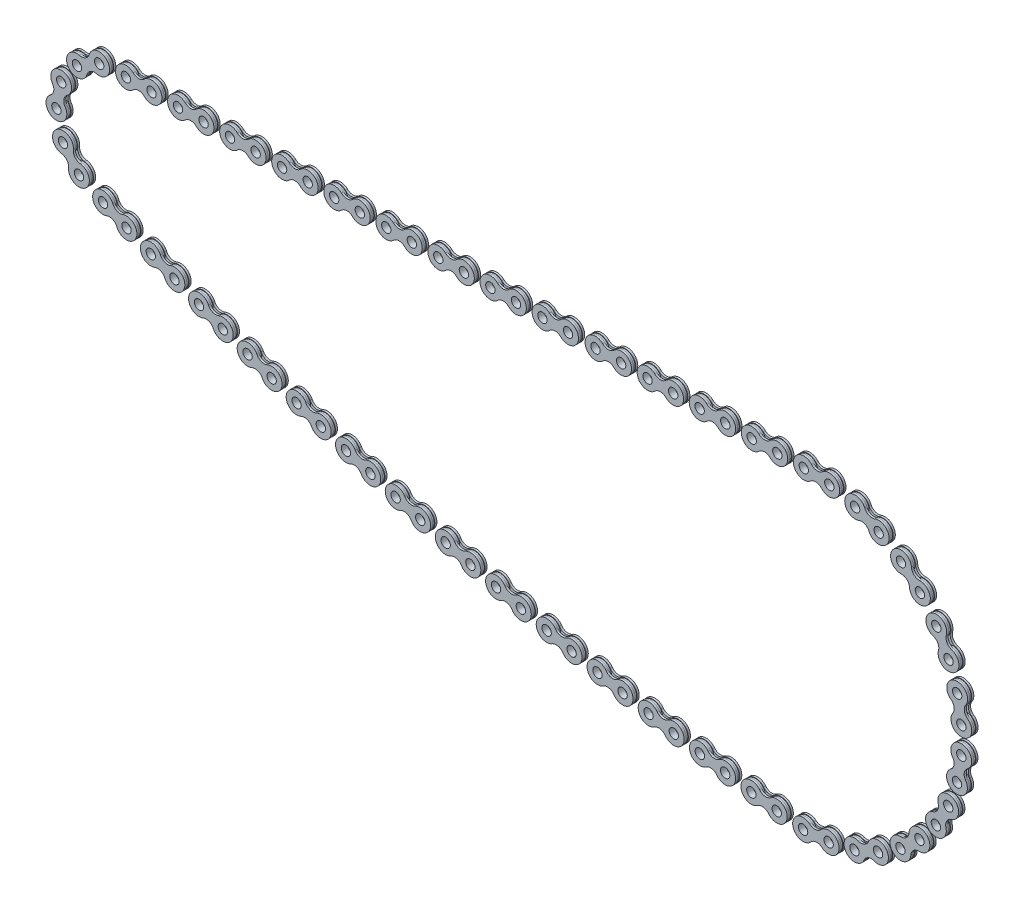
from build123d import *

# Parameters (mm, degrees)
SKETCH1_R             = 4.75
BOSS_EXTRUDE2_DEPTH   = 1
SKETCH1_R_2           = 2.25
BOSS_EXTRUDE2_2_DEPTH = 1
SKETCH2_R             = 2.25
CUT_EXTRUDE1_DEPTH    = 13.057051878
SKETCH3_R             = 2.25
BOSS_EXTRUDE3_DEPTH   = 0.5
CRVPATTERN1_5_ANGLE   = 4.1856236
CRVPATTERN1_6_ANGLE   = 23.2842168
CRVPATTERN1_7_ANGLE   = 42.38281
CRVPATTERN1_8_ANGLE   = 61.4814031
CRVPATTERN1_9_ANGLE   = 80.5799963
CRVPATTERN1_10_ANGLE  = 99.6785895
CRVPATTERN1_11_ANGLE  = 118.7771826
CRVPATTERN1_12_ANGLE  = 137.8757758
CRVPATTERN1_13_ANGLE  = 156.974369
CRVPATTERN1_14_ANGLE  = 176.0729621
CRVPATTERN1_15_ANGLE  = 172.2959829
CRVPATTERN1_16_ANGLE  = 171.0562654
CRVPATTERN1_17_ANGLE  = 169.8165478
CRVPATTERN1_18_ANGLE  = 168.5768302
CRVPATTERN1_19_ANGLE  = 167.3371126
CRVPATTERN1_20_ANGLE  = 166.097395
CRVPATTERN1_21_ANGLE  = 164.8576775
CRVPATTERN1_22_ANGLE  = 163.6179599
CRVPATTERN1_23_ANGLE  = 162.3782423
CRVPATTERN1_24_ANGLE  = 161.1385247
CRVPATTERN1_25_ANGLE  = 159.8988071
CRVPATTERN1_26_ANGLE  = 158.6590895
CRVPATTERN1_27_ANGLE  = 157.419372
CRVPATTERN1_28_ANGLE  = 156.1796544
CRVPATTERN1_29_ANGLE  = 128.6350594
CRVPATTERN1_30_ANGLE  = 79.2591722
CRVPATTERN1_31_ANGLE  = 29.883285


with BuildPart() as part:
    # Sketch1 → Boss-Extrude2 (new, symmetric)
    with BuildSketch(Plane.XY):
        with Locations((-6.15, 0)):
            Circle(SKETCH1_R)
    extrude(amount=BOSS_EXTRUDE2_DEPTH, both=True)

    # Sketch2 → Cut-Extrude1 (cut, through all)
    with BuildSketch(Plane.XY.offset(1)):
        with Locations((-6.15, 0)):
            Circle(SKETCH2_R)
    extrude(amount=-CUT_EXTRUDE1_DEPTH, mode=Mode.SUBTRACT)



with BuildPart() as body_2:
    # Sketch1 → Boss-Extrude2 2 (new, symmetric)
    with BuildSketch(Plane.XY):
        with Locations((6.15, 0)):
            Circle(SKETCH1_R)
        with Locations((6.15, 0)):
            Circle(SKETCH1_R_2, mode=Mode.SUBTRACT)
    extrude(amount=BOSS_EXTRUDE2_2_DEPTH, both=True)


with BuildPart() as part_1:
    add(part.part)

    add(body_2.part)  # Boss-Extrude3 merges body 2
    # Sketch3 → Boss-Extrude3 (add, symmetric)
    with BuildSketch(Plane.XY.offset(1)):
        with BuildLine():
            ThreePointArc((-2.657533512, 3.578082982), (-11.15, 0), (-2.657533512, -3.578082982))
            ThreePointArc((-2.657533512, -3.578082982), (0, -2.496099193), (2.657533512, -3.578082982))
            ThreePointArc((2.657533512, -3.578082982), (11.15, 0), (2.657533512, 3.578082982))
            ThreePointArc((2.657533512, 3.578082982), (0, 2.496099193), (-2.657533512, 3.578082982))
        make_face()
        with Locations((6.15, 0)):
            Circle(SKETCH3_R, mode=Mode.SUBTRACT)
        with Locations((-6.15, 0)):
            Circle(SKETCH3_R, mode=Mode.SUBTRACT)
    extrude(amount=BOSS_EXTRUDE3_DEPTH, both=True)

    # Mirror1: part across plane


with BuildPart() as part_2:
    add(part_1.part)
    add(part_1.part.mirror(Plane.XY))


with BuildPart() as body_2_2:
    # CrvPattern1: read off the stored shape, not the designer's step
    # CrvPattern1: copy of part
    add(part_2.part.moved(Location((25.4789685, 0, 0))))


with BuildPart() as body_3:
    # CrvPattern1 2: copy of part
    add(part_2.part.moved(Location((50.4789685, 0, 0))))


with BuildPart() as body_4:
    # CrvPattern1 3: copy of part
    add(part_2.part.moved(Location((75.4789685, 0, 0))))


with BuildPart() as body_5:
    # CrvPattern1 4: copy of part
    add(part_2.part.moved(Location((100.4789685, 0, 0))))


with BuildPart() as body_6:
    # CrvPattern1 5: copy of part
    add(part_2.part.moved(Location((125.1540352, 8.9585927, 0))).rotate(Axis((0, 0, 0), (0, 0, -1)), CRVPATTERN1_5_ANGLE))


with BuildPart() as body_7:
    # CrvPattern1 6: copy of part
    add(part_2.part.moved(Location((139.8735731, 53.54345, 0))).rotate(Axis((0, 0, 0), (0, 0, -1)), CRVPATTERN1_6_ANGLE))


with BuildPart() as body_8:
    # CrvPattern1 7: copy of part
    add(part_2.part.moved(Location((139.1949739, 100.4903754, 0))).rotate(Axis((0, 0, 0), (0, 0, -1)), CRVPATTERN1_7_ANGLE))


with BuildPart() as body_9:
    # CrvPattern1 8: copy of part
    add(part_2.part.moved(Location((123.1929418, 144.6311646, 0))).rotate(Axis((0, 0, 0), (0, 0, -1)), CRVPATTERN1_8_ANGLE))


with BuildPart() as body_10:
    # CrvPattern1 9: copy of part
    add(part_2.part.moved(Location((93.6290783, 181.1065299, 0))).rotate(Axis((0, 0, 0), (0, 0, -1)), CRVPATTERN1_9_ANGLE))


with BuildPart() as body_11:
    # CrvPattern1 10: copy of part
    add(part_2.part.moved(Location((53.7579541, 205.9010404, 0))).rotate(Axis((0, 0, 0), (0, 0, -1)), CRVPATTERN1_10_ANGLE))


with BuildPart() as body_12:
    # CrvPattern1 11: copy of part
    add(part_2.part.moved(Location((7.9688259, 216.2851649, 0))).rotate(Axis((0, 0, 0), (0, 0, -1)), CRVPATTERN1_11_ANGLE))


with BuildPart() as body_13:
    # CrvPattern1 12: copy of part
    add(part_2.part.moved(Location((-38.6975593, 211.1157555, 0))).rotate(Axis((0, 0, 0), (0, 0, -1)), CRVPATTERN1_12_ANGLE))


with BuildPart() as body_14:
    # CrvPattern1 13: copy of part
    add(part_2.part.moved(Location((-81.1038808, 190.9618925, 0))).rotate(Axis((0, 0, 0), (0, 0, -1)), CRVPATTERN1_13_ANGLE))


with BuildPart() as body_15:
    # CrvPattern1 14: copy of part
    add(part_2.part.moved(Location((-114.5817918, 158.0422361, 0))).rotate(Axis((0, 0, 0), (0, 0, -1)), CRVPATTERN1_14_ANGLE))


with BuildPart() as body_16:
    # CrvPattern1 15: copy of part
    add(part_2.part.moved(Location((-119.1961798, 133.2805744, 0))).rotate(Axis((0, 0, 0), (0, 0, 1)), CRVPATTERN1_15_ANGLE))


with BuildPart() as body_17:
    # CrvPattern1 16: copy of part
    add(part_2.part.moved(Location((-97.053817, 130.9409659, 0))).rotate(Axis((0, 0, 0), (0, 0, 1)), CRVPATTERN1_16_ANGLE))


with BuildPart() as body_18:
    # CrvPattern1 17: copy of part
    add(part_2.part.moved(Location((-74.8660186, 129.0809654, 0))).rotate(Axis((0, 0, 0), (0, 0, 1)), CRVPATTERN1_17_ANGLE))


with BuildPart() as body_19:
    # CrvPattern1 18: copy of part
    add(part_2.part.moved(Location((-52.6431718, 127.7014436, 0))).rotate(Axis((0, 0, 0), (0, 0, 1)), CRVPATTERN1_18_ANGLE))


with BuildPart() as body_20:
    # CrvPattern1 19: copy of part
    add(part_2.part.moved(Location((-30.3956802, 126.8030463, 0))).rotate(Axis((0, 0, 0), (0, 0, 1)), CRVPATTERN1_19_ANGLE))


with BuildPart() as body_21:
    # CrvPattern1 20: copy of part
    add(part_2.part.moved(Location((-8.1339589, 126.3861942, 0))).rotate(Axis((0, 0, 0), (0, 0, 1)), CRVPATTERN1_20_ANGLE))


with BuildPart() as body_22:
    # CrvPattern1 21: copy of part
    add(part_2.part.moved(Location((14.1315703, 126.4510824, 0))).rotate(Axis((0, 0, 0), (0, 0, 1)), CRVPATTERN1_21_ANGLE))


with BuildPart() as body_23:
    # CrvPattern1 22: copy of part
    add(part_2.part.moved(Location((36.3904838, 126.9976804, 0))).rotate(Axis((0, 0, 0), (0, 0, 1)), CRVPATTERN1_22_ANGLE))


with BuildPart() as body_24:
    # CrvPattern1 23: copy of part
    add(part_2.part.moved(Location((58.6323612, 128.0257325, 0))).rotate(Axis((0, 0, 0), (0, 0, 1)), CRVPATTERN1_23_ANGLE))


with BuildPart() as body_25:
    # CrvPattern1 24: copy of part
    add(part_2.part.moved(Location((80.8467899, 129.5347573, 0))).rotate(Axis((0, 0, 0), (0, 0, 1)), CRVPATTERN1_24_ANGLE))


with BuildPart() as body_26:
    # CrvPattern1 25: copy of part
    add(part_2.part.moved(Location((103.0233704, 131.5240483, 0))).rotate(Axis((0, 0, 0), (0, 0, 1)), CRVPATTERN1_25_ANGLE))


with BuildPart() as body_27:
    # CrvPattern1 26: copy of part
    add(part_2.part.moved(Location((125.1517206, 133.9926744, 0))).rotate(Axis((0, 0, 0), (0, 0, 1)), CRVPATTERN1_26_ANGLE))


with BuildPart() as body_28:
    # CrvPattern1 27: copy of part
    add(part_2.part.moved(Location((147.2214813, 136.9394797, 0))).rotate(Axis((0, 0, 0), (0, 0, 1)), CRVPATTERN1_27_ANGLE))


with BuildPart() as body_29:
    # CrvPattern1 28: copy of part
    add(part_2.part.moved(Location((169.2223206, 140.3630849, 0))).rotate(Axis((0, 0, 0), (0, 0, 1)), CRVPATTERN1_28_ANGLE))


with BuildPart() as body_30:
    # CrvPattern1 29: copy of part
    add(part_2.part.moved(Location((108.3728038, 211.0597742, 0))).rotate(Axis((0, 0, 0), (0, 0, 1)), CRVPATTERN1_29_ANGLE))


with BuildPart() as body_31:
    # CrvPattern1 30: copy of part
    add(part_2.part.moved(Location((-67.6144491, 229.7961329, 0))).rotate(Axis((0, 0, 0), (0, 0, 1)), CRVPATTERN1_30_ANGLE))


with BuildPart() as body_32:
    # CrvPattern1 31: copy of part
    add(part_2.part.moved(Location((-196.4194871, 108.421397, 0))).rotate(Axis((0, 0, 0), (0, 0, 1)), CRVPATTERN1_31_ANGLE))


with BuildPart() as body_33:
    # CrvPattern1 32: copy of part
    add(part_2.part.moved(Location((-200, 0, 0))))


with BuildPart() as body_34:
    # CrvPattern1 33: copy of part
    add(part_2.part.moved(Location((-175, 0, 0))))


with BuildPart() as body_35:
    # CrvPattern1 34: copy of part
    add(part_2.part.moved(Location((-150, 0, 0))))


with BuildPart() as body_36:
    # CrvPattern1 35: copy of part
    add(part_2.part.moved(Location((-125, 0, 0))))


with BuildPart() as body_37:
    # CrvPattern1 36: copy of part
    add(part_2.part.moved(Location((-100, 0, 0))))


with BuildPart() as body_38:
    # CrvPattern1 37: copy of part
    add(part_2.part.moved(Location((-75, 0, 0))))


with BuildPart() as body_39:
    # CrvPattern1 38: copy of part
    add(part_2.part.moved(Location((-50, 0, 0))))


with BuildPart() as body_40:
    # CrvPattern1 39: copy of part
    add(part_2.part.moved(Location((-25, 0, 0))))


solid = Compound([part_2.part, body_2_2.part, body_3.part, body_4.part, body_5.part, body_6.part, body_7.part, body_8.part, body_9.part, body_10.part, body_11.part, body_12.part, body_13.part, body_14.part, body_15.part, body_16.part, body_17.part, body_18.part, body_19.part, body_20.part, body_21.part, body_22.part, body_23.part, body_24.part, body_25.part, body_26.part, body_27.part, body_28.part, body_29.part, body_30.part, body_31.part, body_32.part, body_33.part, body_34.part, body_35.part, body_36.part, body_37.part, body_38.part, body_39.part, body_40.part])
